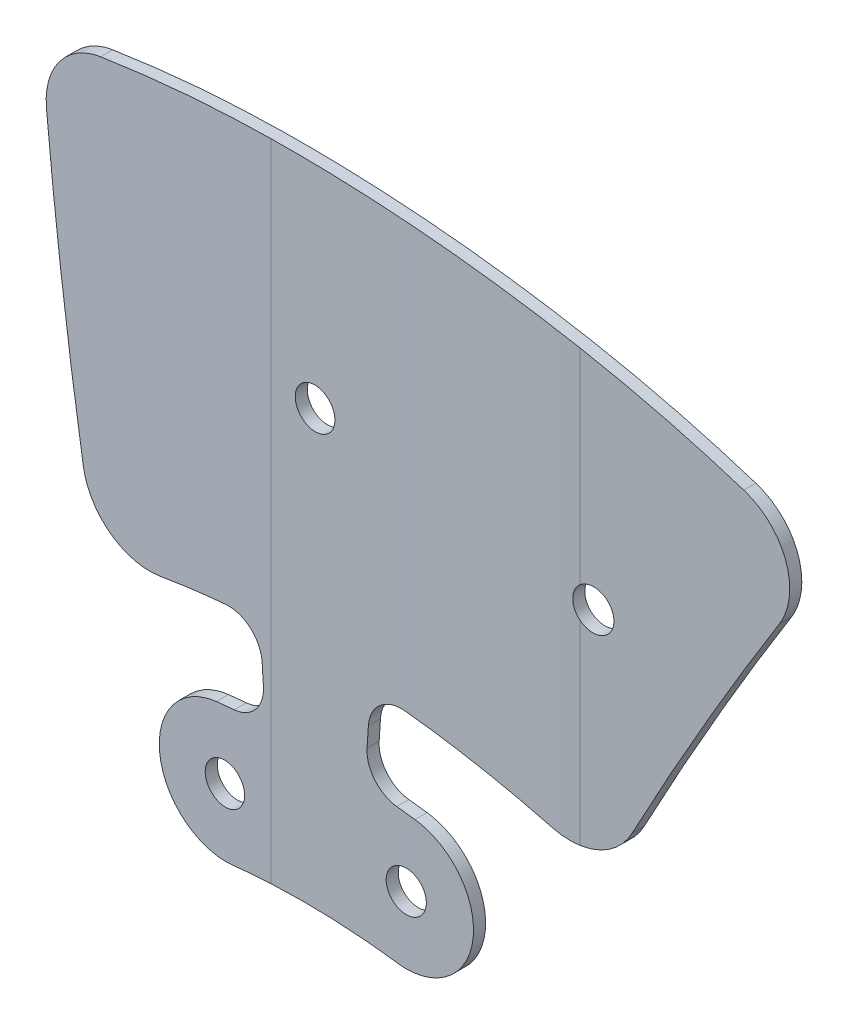
from build123d import *

# Parameters (mm, degrees)
SKETCH9_W               = 63
SKETCH9_H               = 97
BOSS_EXTRUDE3_DEPTH     = 0.9
FLEX1_DEPTH             = 97
FLEX1_2_DEPTH           = 97
HOLES_DEPTH             = 105.800393682
HOLES_DEPTH_BACK        = 105.800393682
SKETCH10_R              = 1.5
CUT_EXTRUDE2_DEPTH      = 105.800393775
CUT_EXTRUDE2_DEPTH_BACK = 105.800393775
SKETCH11_W              = 63.006108503
SKETCH11_H              = 97
FILLET1_START           = -0.513450093
FILLET1_DEPTH           = 1.413450171
FILLET2_R               = 2.5


with BuildPart() as part:
    # Sketch9 → Boss-Extrude3 (new body)
    with BuildSketch(Plane.XY):
        with Locations((8.161949416, 48.5)):
            Rectangle(SKETCH9_W, SKETCH9_H)
    extrude(amount=BOSS_EXTRUDE3_DEPTH)

    # Flex1: read off the stored shape, not the designer's step
    # Flex1 outline → Flex1 (cut)
    with BuildSketch(Plane(origin=(0, 0, 0), x_dir=(1, 0, 0), z_dir=(0, 1, 0))):
        Polygon((39.661949416, 0), (39.657624847, 0), (39.661949416, -0.1981922), align=None)
        Polygon((-23.338050584, -0.198192162), (-23.333726016, 0), (-23.338050584, 0), align=None)
        with BuildLine():
            Line((39.661949416, -0.9), (39.661949416, -0.33823319))
            Line((39.661949416, -0.33823319), (19.669763126, -0.774464246))
            ThreePointArc((19.669763126, -0.774464246), (13.91619862, -0.868615128), (8.161949416, -0.9))
            Line((8.161949416, -0.9), (39.661949416, -0.9))
        make_face()
        with BuildLine():
            Line((-3.345864294, -0.774464246), (-23.338050584, -0.33823319))
            Line((-23.338050584, -0.33823319), (-23.338050584, -0.9))
            Line((-23.338050584, -0.9), (8.161949416, -0.9))
            ThreePointArc((8.161949416, -0.9), (2.407700212, -0.868615128), (-3.345864294, -0.774464246))
        make_face()
    extrude(amount=FLEX1_DEPTH, mode=Mode.SUBTRACT)

    # Flex1 2 outline → Flex1 2 (add)
    with BuildSketch(Plane(origin=(0, 0, 0), x_dir=(1, 0, 0), z_dir=(0, 1, 0))):
        with BuildLine():
            ThreePointArc((8.161950743, 0), (2.417518157, 0.031331319), (-3.326230898, 0.125321578))
            Line((-3.326230898, 0.125321578), (-23.321471439, 0.561619279))
            Line((-23.321471439, 0.561619279), (-23.333726016, 0))
            Line((-23.333726016, 0), (8.161950743, 0))
        make_face()
        with BuildLine():
            ThreePointArc((19.650129729, 0.125321578), (13.906382001, 0.031331334), (8.161950743, 0))
            Line((8.161950743, 0), (39.657624847, 0))
            Line((39.657624847, 0), (39.645370271, 0.561619279))
            Line((39.645370271, 0.561619279), (19.650129729, 0.125321578))
        make_face()
        Polygon((39.665003667, -0.338166546), (39.661949416, -0.1981922), (39.661949416, -0.33823319), align=None)
        Polygon((-23.338050584, -0.33823319), (-23.338050584, -0.198192162), (-23.341104836, -0.338166546), align=None)
    extrude(amount=FLEX1_2_DEPTH)

    # Sketch10 → Holes (cut, two sides: drawn at the far end of the back side and taken through both)
    with BuildSketch(Plane.XY.offset(-HOLES_DEPTH_BACK)):
        with Locations(Location((0, 79.75, 0), (0, 0, 180))):
            Circle(SKETCH10_R)
        with Locations(Location((20.640818847, 77.032584647, 0), (0, 0, 228.665080439))):
            Circle(SKETCH10_R)
        with Locations(Location((-6.852625092, 52.050855222, 0), (0, 0, 180))):
            Circle(SKETCH10_R)
        with Locations(Location((6.852625092, 52.050855222, 0), (0, 0, 180))):
            Circle(SKETCH10_R)
    extrude(amount=HOLES_DEPTH + HOLES_DEPTH_BACK, mode=Mode.SUBTRACT)

    # Sketch11 → Cut-Extrude2 (cut, two sides: drawn at the far end of the back side and taken through both)
    with BuildSketch(Plane.XY.offset(-CUT_EXTRUDE2_DEPTH_BACK)):
        with Locations((8.161949415, 48.5)):
            Rectangle(SKETCH11_W, SKETCH11_H)
        with BuildLine():
            Line((4.185800271, 63.862971087), (3.760679931, 57.376888086))
            ThreePointArc((3.760679931, 57.376888086), (5.635985569, 57.223121784), (7.505256053, 57.008079529))
            ThreePointArc((7.505256053, 57.008079529), (11.809849398, 51.398224261), (6.19999413, 47.093630915))
            ThreePointArc((6.19999413, 47.093630915), (0, 47.5), (-6.19999413, 47.093630915))
            ThreePointArc((-6.19999413, 47.093630915), (-11.809849398, 51.398224261), (-7.505256053, 57.008079529))
            ThreePointArc((-7.505256053, 57.008079529), (-5.635985569, 57.223121784), (-3.760679931, 57.376888086))
            Line((-3.760679931, 57.376888086), (-4.185800271, 63.862971087))
            ThreePointArc((-4.185800271, 63.862971087), (-10.501653038, 63.132521599), (-16.713864661, 61.779015273))
            ThreePointArc((-16.713864661, 61.779015273), (-19.180957256, 77.436335693), (-20.828588873, 93.200965046))
            ThreePointArc((-20.828588873, 93.200965046), (8.724041697, 95.100689253), (37.437803154, 87.855909847))
            ThreePointArc((37.437803154, 87.855909847), (29.127303266, 74.268784811), (21.532663784, 60.268933874))
            ThreePointArc((21.532663784, 60.268933874), (12.984187468, 62.669058361), (4.185800271, 63.862971087))
        make_face(mode=Mode.SUBTRACT)
    extrude(amount=CUT_EXTRUDE2_DEPTH + CUT_EXTRUDE2_DEPTH_BACK, mode=Mode.SUBTRACT)

    # Fillet1: read off the stored shape, not the designer's step
    # Fillet1 outline → Fillet1 (cut)
    with BuildSketch(Plane.XY.offset(FILLET1_START)):
        with BuildLine():
            ThreePointArc((-16.713864661, 61.779015273), (-14.256840633, 62.391846384), (-11.777496683, 62.906999387))
            ThreePointArc((-11.777496683, 62.906999387), (-15.563592629, 63.724516542), (-17.629773662, 67.000757185))
            ThreePointArc((-17.629773662, 67.000757185), (-17.183202347, 64.387889585), (-16.713864661, 61.779015273))
        make_face()
        with BuildLine():
            ThreePointArc((21.532663784, 60.268933874), (22.490522566, 62.133675811), (23.461092679, 63.991833391))
            ThreePointArc((23.461092679, 63.991833391), (20.999228882, 61.722888632), (17.657666024, 61.515907135))
            ThreePointArc((17.657666024, 61.515907135), (19.605081566, 60.923236756), (21.532663784, 60.268933874))
        make_face()
        with BuildLine():
            ThreePointArc((37.437803154, 87.855909847), (34.544505688, 89.033292238), (31.614250404, 90.115421385))
            ThreePointArc((31.614250404, 90.115421385), (34.674360622, 87.060431172), (34.20794214, 82.761629764))
            ThreePointArc((34.20794214, 82.761629764), (35.810360655, 85.316702623), (37.437803154, 87.855909847))
        make_face()
        with BuildLine():
            ThreePointArc((-20.828588873, 93.200965046), (-20.644293019, 90.952269753), (-20.443312617, 88.705004224))
            ThreePointArc((-20.443312617, 88.705004224), (-19.435950656, 92.207056404), (-16.319289437, 94.095328217))
            ThreePointArc((-16.319289437, 94.095328217), (-18.579321492, 93.675283895), (-20.828588873, 93.200965046))
        make_face()
    extrude(amount=FILLET1_DEPTH, mode=Mode.SUBTRACT)

    # Fillet2
    fillet2_edges = [part.edges().sort_by_distance(p)[0] for p in [
        (3.760679931, 57.376888086, 0.431623426),
        (-3.760679931, 57.376888086, 0.315305823),
        (4.185800271, 63.862971087, 0.435002027),
        (-4.185800271, 63.862971087, 0.306029665),
    ]]
    fillet(fillet2_edges, radius=FILLET2_R)


solid = part.part
